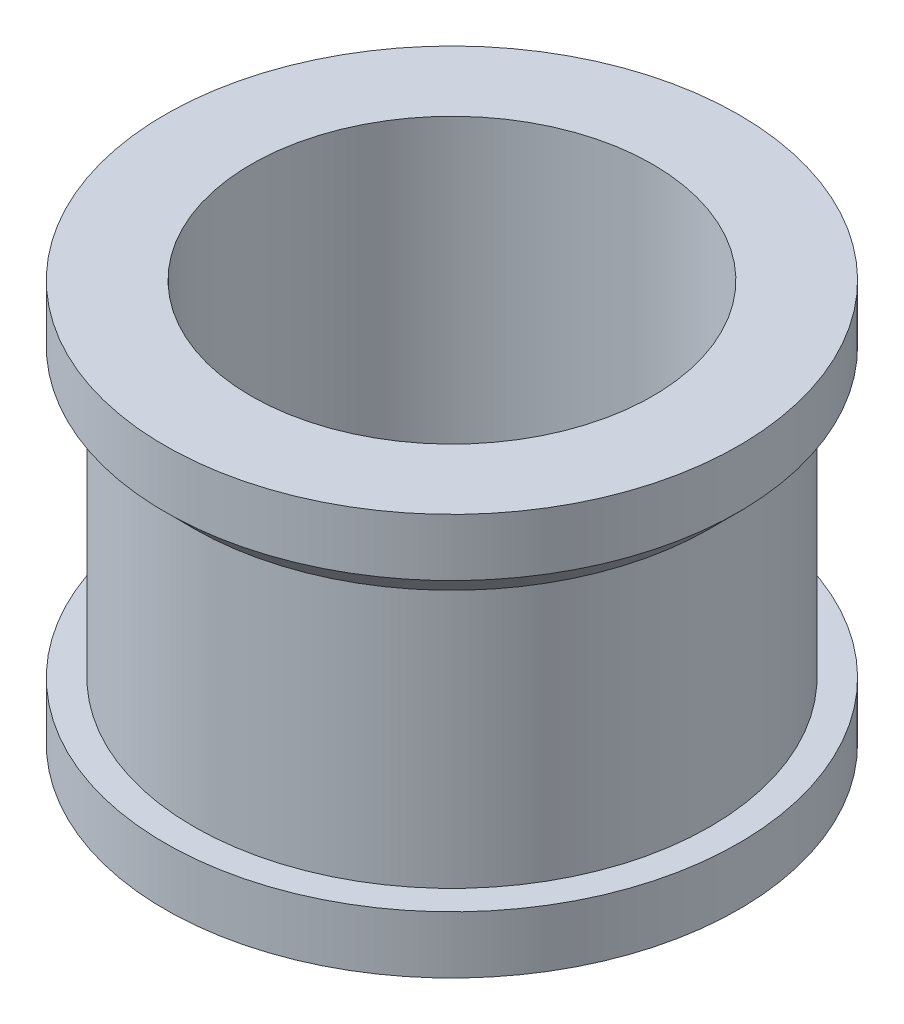
from build123d import *

# Parameters (mm, degrees)
CHAMFER1_SIZE = 1


with BuildPart() as part:
    # Sketch1 → Revolve1 (revolve)
    with BuildSketch(Plane.XY, mode=Mode.PRIVATE) as revolve1_sk:
        Polygon((7, 0), (7, 14), (10, 14), (10, 12), (9, 12), (9, 2), (10, 2), (10, 0), align=None)
    revolve(revolve1_sk.sketch.rotate(Axis((0, 0.1, 0), (0, 1, 0)), 90), axis=Axis((0, 0.1, 0), (0, 1, 0)))

    # Chamfer1
    chamfer1_edges = [part.edges().sort_by_distance(p)[0] for p in [
        (0, 12, 9),
    ]]
    chamfer(chamfer1_edges, length=CHAMFER1_SIZE - 0.0001)  # a hair under: the kernel refuses the full size


solid = part.part
